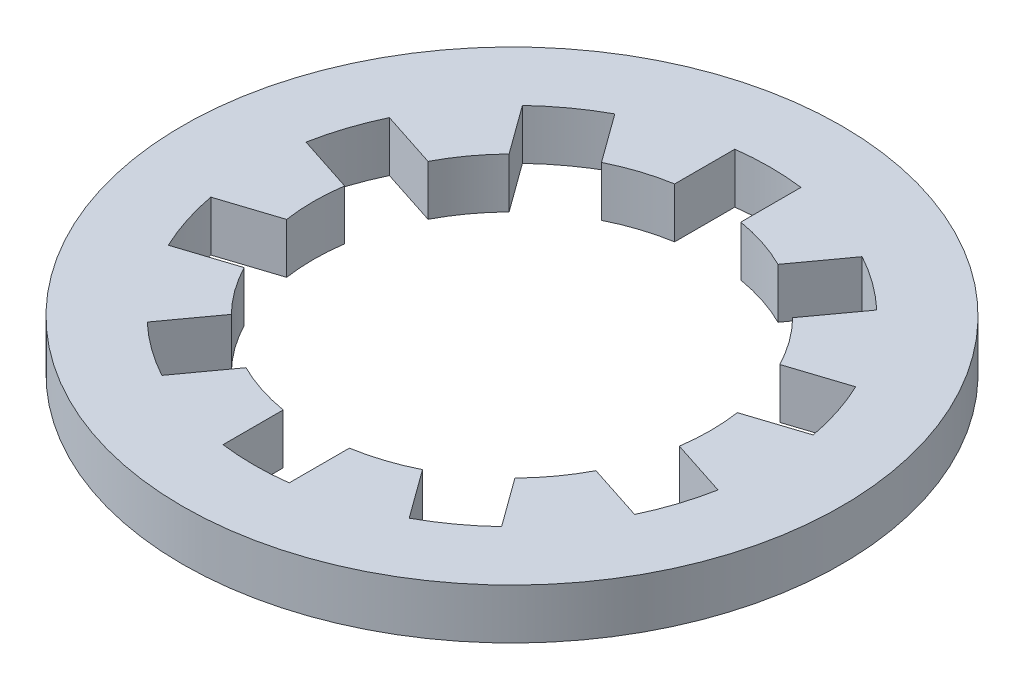
from build123d import *

# Parameters (mm, degrees)
SKETCH1_R          = 11.176
SKETCH1_R_2        = 6.731
EXTRUDE1_DEPTH     = 1.7018
CUT_EXTRUDE1_DEPTH = 16.896605777
CIRPATTERN1_COUNT  = 10


with BuildPart() as part:
    # Sketch1 → Extrude1 (new body)
    with BuildSketch(Plane(origin=(0, 0, 0), x_dir=(1, 0, 0), z_dir=(0, 1, 0))):
        Circle(SKETCH1_R)
        Circle(SKETCH1_R_2, mode=Mode.SUBTRACT)
    extrude(amount=EXTRUDE1_DEPTH)

    # Sketch2 → Cut-Extrude1 (cut, through all)
    with BuildSketch(Plane(origin=(0, 1.7018, 0), x_dir=(-1, 0, 0), z_dir=(0, 1, 0))):
        with BuildLine():
            Line((-1.121833333, 8.678089655), (-1.121833333, 6.636855503))
            ThreePointArc((-1.121833333, 6.636855503), (0, 6.731), (1.121833333, 6.636855503))
            Line((1.121833333, 6.636855503), (1.121833333, 8.678089655))
            ThreePointArc((1.121833333, 8.678089655), (0, 8.7503), (-1.121833333, 8.678089655))
        make_face()
    cut_extrude1 = extrude(amount=-CUT_EXTRUDE1_DEPTH, mode=Mode.SUBTRACT)

    # CirPattern1: Cut-Extrude1 ×10 about axis
    cirpattern1_axis = Axis((0, 10.43146551, 0), (0, -1, 0))
    for i in range(1, CIRPATTERN1_COUNT):
        add(cut_extrude1.rotate(cirpattern1_axis, i * 360 / CIRPATTERN1_COUNT), mode=Mode.SUBTRACT)


solid = part.part
